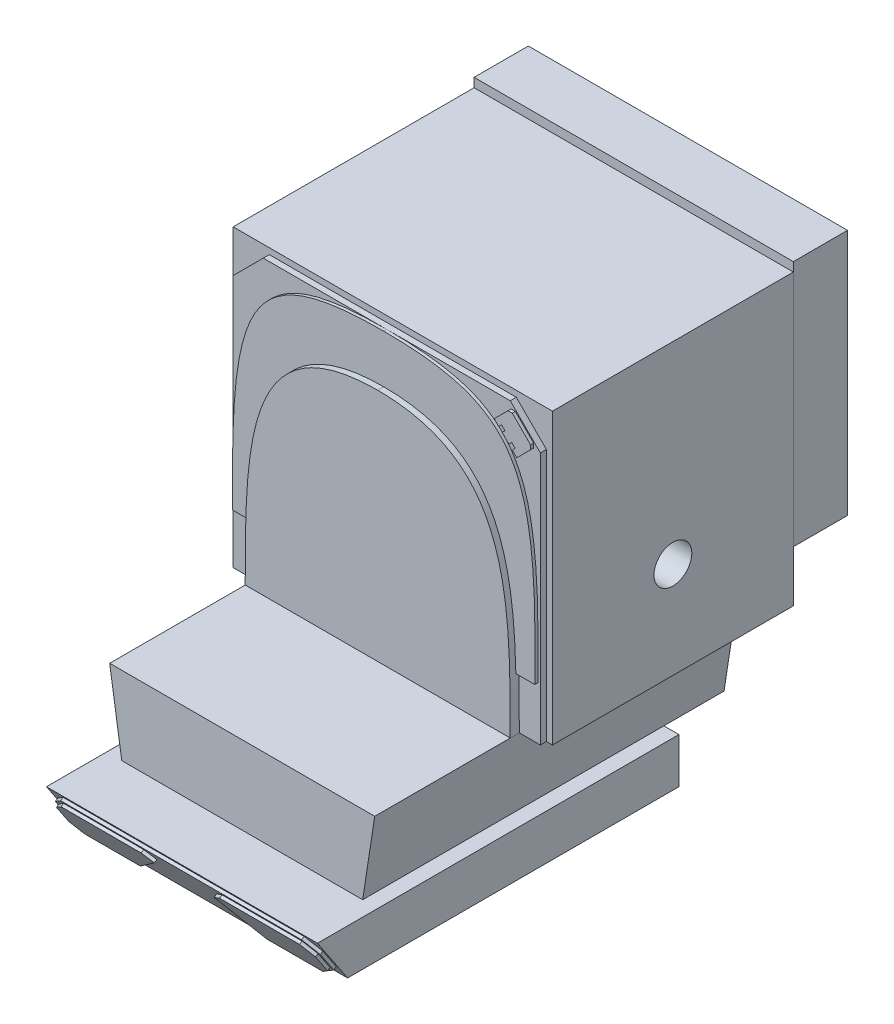
from build123d import *

# Parameters (mm, degrees)
SKETCH1_W               = 45
SKETCH1_H               = 60
BOSS_EXTRUDE1_DEPTH     = 7.5
BOSS_EXTRUDE2_START     = -10
BOSS_EXTRUDE2_DEPTH     = 60
BOSS_EXTRUDE3_START     = -25
SKETCH3_W               = 53
SKETCH3_H               = 48
BOSS_EXTRUDE3_DEPTH     = 40
SKETCH4_W               = 53
SKETCH4_H               = 41
BOSS_EXTRUDE4_DEPTH     = 9
SKETCH5_R               = 4.550637102
HIPSWIVELMOUNT_DEPTH    = 1
SKETCH6_R               = 3.140190551
ARMMOUNTS_DEPTH         = 104.07764064
CUT_EXTRUDE1_DEPTH      = 93.294366025
CUT_EXTRUDE1_DEPTH_BACK = 93.294366025
BOSS_EXTRUDE5_DEPTH     = 0.5
BOSS_EXTRUDE6_DEPTH     = 0.5
BOSS_EXTRUDE44_DEPTH    = 2.5
BOSS_EXTRUDE45_DEPTH    = 1
BOSS_EXTRUDE46_DEPTH    = 0.5
BOSS_EXTRUDE47_DEPTH    = 0.5


with BuildPart() as part:
    # Sketch1 → Boss-Extrude1 (new body)
    with BuildSketch(Plane(origin=(0, 0, 0), x_dir=(1, 0, 0), z_dir=(0, 1, 0))):
        Rectangle(SKETCH1_W, SKETCH1_H)
    extrude(amount=BOSS_EXTRUDE1_DEPTH)

    # Sketch2 → Boss-Extrude2 (add)
    with BuildSketch(Plane.XY.offset(30).offset(BOSS_EXTRUDE2_START)):
        Polygon((-22, 20.5), (22, 20.5), (20, 7.5), (-20, 7.5), align=None)
    extrude(amount=-BOSS_EXTRUDE2_DEPTH)

    # Sketch3 → Boss-Extrude3 (add)
    with BuildSketch(Plane.XY.offset(20).offset(BOSS_EXTRUDE3_START)):
        with Locations((0, 44.5)):
            Rectangle(SKETCH3_W, SKETCH3_H)
    extrude(amount=-BOSS_EXTRUDE3_DEPTH)

    # Sketch5 → HipSwivelMount (cut)
    with BuildSketch(Plane.XZ):
        with Locations((0, -7)):
            Circle(SKETCH5_R)
    extrude(amount=-HIPSWIVELMOUNT_DEPTH, mode=Mode.SUBTRACT)

    # Sketch6 → ArmMounts (cut, through all)
    with BuildSketch(Plane.ZY.offset(26.5)):
        with Locations((-25, 36.5)):
            Circle(SKETCH6_R)
    extrude(amount=-ARMMOUNTS_DEPTH, mode=Mode.SUBTRACT)

    # Sketch7 → Cut-Extrude1 (cut, two sides: drawn at the far end of the back side and taken through both)
    with BuildSketch(Plane(origin=(0, 0, 0), x_dir=(0, 0, -1), z_dir=(1, 0, 0)).offset(-CUT_EXTRUDE1_DEPTH_BACK)):
        Polygon((-25.003118647, 0), (-30, 0), (-30, 7.5), align=None)
    extrude(amount=CUT_EXTRUDE1_DEPTH + CUT_EXTRUDE1_DEPTH_BACK, mode=Mode.SUBTRACT)

    # Sketch8 → Boss-Extrude5 (add)
    with BuildSketch(Plane(origin=(0, -11.537130094, 17.316495949), x_dir=(1, 0, 0), z_dir=(0, -0.5544606006991946, 0.8322099748694968))):
        Polygon((-20, 22.375392832), (-22, 20.375392832), (-22, 16.363244184), (-20, 14.363244184), (20, 14.363244184), (22, 16.363244184), (22, 20.375392832), (20, 22.375392832), align=None)
    extrude(amount=BOSS_EXTRUDE5_DEPTH)

    # Sketch9 → Boss-Extrude6 (add)
    with BuildSketch(Plane(origin=(0, -11.814360395, 17.732600936), x_dir=(1, 0, 0), z_dir=(0, -0.5544606006991939, 0.8322099748694973))):
        Polygon((-6.5, 21.875392832), (-4.959773245, 20.703348605), (-10.5, 14.863244184), (-19.792893219, 14.863244184), (-21.5, 16.570350966), (-21.5, 20.168286051), (-19.792893219, 21.875392832), align=None)
        Polygon((19.792893219, 14.863244184), (10.5, 14.863244184), (4.959773245, 20.703348605), (6.5, 21.875392832), (19.792893219, 21.875392832), (21.5, 20.168286051), (21.5, 16.570350966), align=None)
    extrude(amount=BOSS_EXTRUDE6_DEPTH)

    # Sketch55 → Boss-Extrude44 (add)
    with BuildSketch(Plane.XY.offset(-5)):
        with BuildLine():
            Line((22, 20.5), (-22, 20.5))
            add(Edge.make_bspline(
                [(-22, 20.5), (-22, 40.682760836), (-22, 59.5), (0, 59.5)],
                knots=[0, 0, 0, 0, 1, 1, 1, 1], degree=3))
            add(Edge.make_bspline(
                [(22, 20.5), (22, 40.682760836), (22, 59.5), (0, 59.5)],
                knots=[0, 0, 0, 0, 1, 1, 1, 1], degree=3))
        make_face()
    extrude(amount=BOSS_EXTRUDE44_DEPTH)

    # Sketch56 → Boss-Extrude45 (add)
    with BuildSketch(Plane.XY.offset(-5)):
        Polygon((-25.5, 21.5), (-25.5, 20.5), (25.5, 20.5), (25.5, 21.5), (25.5, 62.5), (20.5, 67.5), (-20.5, 67.5), (-25.5, 62.5), align=None)
    extrude(amount=BOSS_EXTRUDE45_DEPTH)

    # Sketch57 → Boss-Extrude46 (add)
    with BuildSketch(Plane.XY.offset(-4)):
        Polygon((21.341222998, 66.380372149), (24.378806044, 63.339920995), (24.378136932, 62.630938173), (22.080061659, 60.335030713), (21.338080751, 61.077712205), (21.810038851, 61.549225098), (21.242587003, 62.117212738), (20.770628903, 61.645699845), (19.643597343, 62.773795557), (20.115555443, 63.24530845), (19.548103595, 63.813296091), (19.076145495, 63.341783197), (18.334164588, 64.084464689), (20.632239862, 66.380372149), align=None)
    extrude(amount=BOSS_EXTRUDE46_DEPTH)

    # Sketch58 → Boss-Extrude47 (add)
    with BuildSketch(Plane.XY.offset(-4)):
        with BuildLine():
            Line((25.0734645, 29.232815571), (-25.0734645, 29.232815571))
            add(Edge.make_bspline(
                [(-25.0734645, 29.232815571), (-25.5, 56.679447944), (-23.388070384, 65.264965377), (-12.670969058, 67.5), (0, 67.5)],
                knots=[0, 0, 0, 0, 0, 1, 1, 1, 1, 1], degree=4))
            add(Edge.make_bspline(
                [(25.0734645, 29.232815571), (25.5, 56.679447944), (23.388070384, 65.264965377), (12.670969058, 67.5), (0, 67.5)],
                knots=[0, 0, 0, 0, 0, 1, 1, 1, 1, 1], degree=4))
        make_face()
    extrude(amount=BOSS_EXTRUDE47_DEPTH)


with BuildPart() as body_2:
    # Sketch4 → Boss-Extrude4 (new body)
    with BuildSketch(Plane(origin=(0, 0, -45), x_dir=(-1, 0, 0), z_dir=(0, 0, -1))):
        with Locations((0, 49.5)):
            Rectangle(SKETCH4_W, SKETCH4_H)
    extrude(amount=BOSS_EXTRUDE4_DEPTH)


solid = Compound([part.part, body_2.part])
